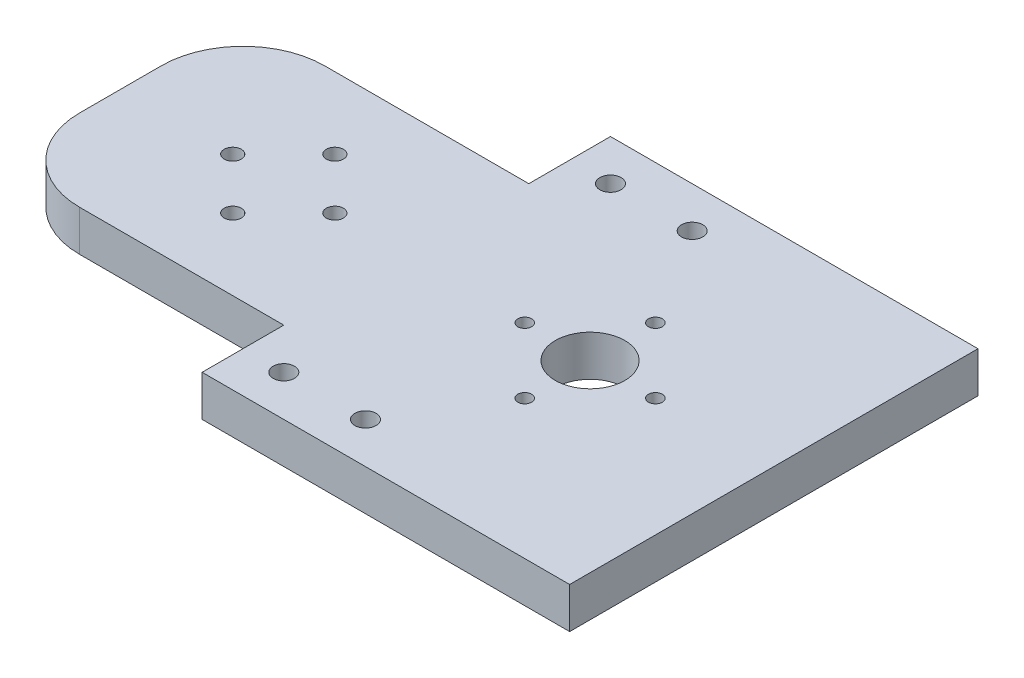
from build123d import *

# Parameters (mm, degrees)
EXTRUDE_2_DEPTH      = 10
FILLET_2_R           = 20
SKETCH_4_R           = 2.6
CUT_EXTRUDE_2_DEPTH  = 168.928556237
SKETCH_5_R           = 8.5
CUT_EXTRUDE_3_DEPTH  = 168.928556237
SKETCH_17_R          = 1.7
CUT_EXTRUDE_11_DEPTH = 10
SKETCH_18_R          = 2.1
CUT_EXTRUDE_12_DEPTH = 10


with BuildPart() as part:
    # 草图2 → 凸台-拉伸2 (new body)
    with BuildSketch(Plane(origin=(0, 0, 0), x_dir=(1, 0, 0), z_dir=(0, 1, 0))):
        Polygon((0, 50), (0, -50), (-90, -50), (-90, -30), (-160, -30), (-160, 30), (-90, 30), (-90, 50), align=None)
    extrude(amount=EXTRUDE_2_DEPTH)

    # 圆角2
    fillet_2_edges = [part.edges().sort_by_distance(p)[0] for p in [
        (-160, 5, 30),
        (-160, 5, -30),
    ]]
    fillet(fillet_2_edges, radius=FILLET_2_R)

    # 草图4 → 切除-拉伸2 (cut, through all)
    with BuildSketch(Plane(origin=(0, 10, 0), x_dir=(1, 0, 0), z_dir=(0, 1, 0))):
        with Locations((-60, -40)):
            Circle(SKETCH_4_R)
        with Locations((-80, -40)):
            Circle(SKETCH_4_R)
        with Locations((-80, 40)):
            Circle(SKETCH_4_R)
        with Locations((-60, 40)):
            Circle(SKETCH_4_R)
    extrude(amount=-CUT_EXTRUDE_2_DEPTH, mode=Mode.SUBTRACT)

    # 草图5 → 切除-拉伸3 (cut, through all)
    with BuildSketch(Plane.XZ):
        with Locations((-45, 0)):
            Circle(SKETCH_5_R)
    extrude(amount=-CUT_EXTRUDE_3_DEPTH, mode=Mode.SUBTRACT)

    # 草图17 → 切除-拉伸11 (cut)
    with BuildSketch(Plane.XZ):
        with Locations((-45, 16)):
            Circle(SKETCH_17_R)
        with Locations((-45, -16)):
            Circle(SKETCH_17_R)
        with Locations((-29, 0)):
            Circle(SKETCH_17_R)
        with Locations((-61, 0)):
            Circle(SKETCH_17_R)
    extrude(amount=-CUT_EXTRUDE_11_DEPTH, mode=Mode.SUBTRACT)

    # 草图18 → 切除-拉伸12 (cut)
    with BuildSketch(Plane.XZ):
        with Locations((-120, 12.5)):
            Circle(SKETCH_18_R)
        with Locations((-132.5, 0)):
            Circle(SKETCH_18_R)
        with Locations((-120, -12.5)):
            Circle(SKETCH_18_R)
        with Locations((-107.5, 0)):
            Circle(SKETCH_18_R)
    extrude(amount=-CUT_EXTRUDE_12_DEPTH, mode=Mode.SUBTRACT)


solid = part.part
